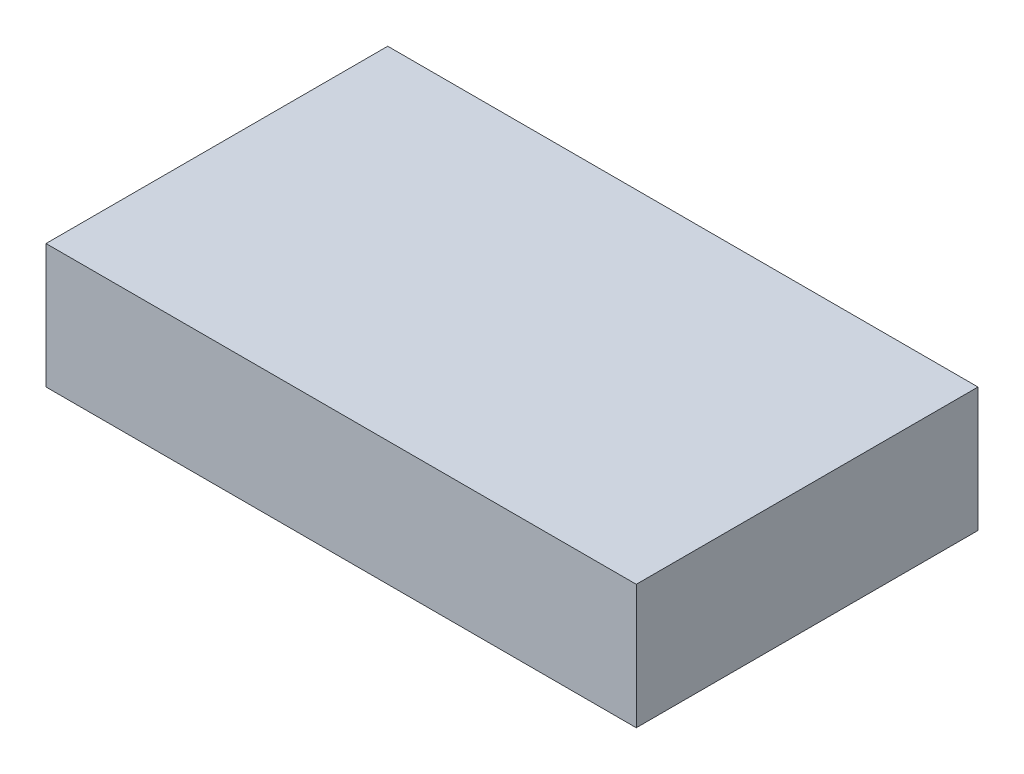
from build123d import *

# Parameters (mm, degrees)
SKETCH1_W           = 120.65
SKETCH1_H           = 69.85
BOSS_EXTRUDE1_DEPTH = 25.4


with BuildPart() as part:
    # Sketch1 → Boss-Extrude1 (new body)
    with BuildSketch(Plane(origin=(0, 0, 0), x_dir=(1, 0, 0), z_dir=(0, 1, 0))):
        with Locations((12.862542662, -2.633191126)):
            Rectangle(SKETCH1_W, SKETCH1_H)
    extrude(amount=BOSS_EXTRUDE1_DEPTH)


solid = part.part
